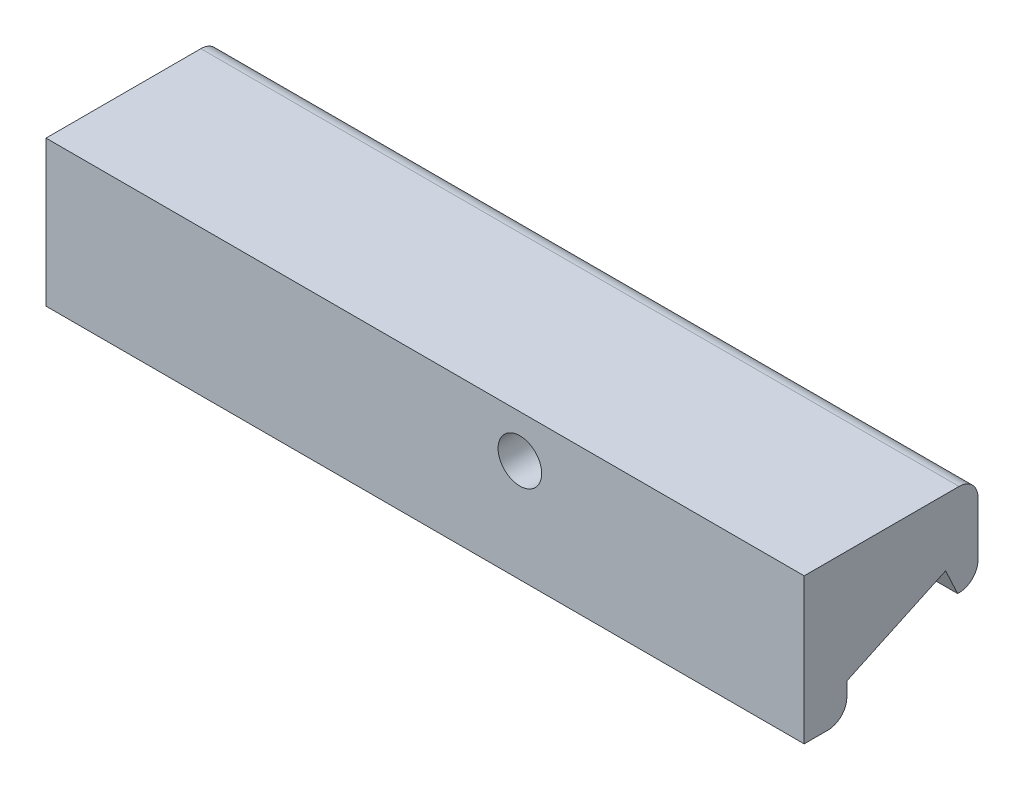
from build123d import *

# Parameters (mm, degrees)
PROFILEBOSS_EXTRUDE1_DEPTH           = 80
SKETCH2_R                            = 2.3
LEDSTRIPMOUNTHOLESCUT_EXTRUDE1_DEPTH = 4.5
SKETCH4_W                            = 28
SKETCH4_H                            = 11.5
POWERCONNECTORCUT_EXTRUDE4_DEPTH     = 6.5
SKETCH3_R                            = 2.3
MOUNTINGHOLESCUT_EXTRUDE3_DEPTH      = 4.5


with BuildPart() as part:
    # Sketch1 → ProfileBoss-Extrude1 (new body)
    with BuildSketch(Plane(origin=(0, 0, 0), x_dir=(0, 0, -1), z_dir=(1, 0, 0))):
        with BuildLine():
            Line((0, 0), (2.499461553, 0))
            ThreePointArc((2.499461553, 0), (3.914055855, 0.585944145), (4.5, 2.000538447))
            Line((4.5, 2.000538447), (4.5, 3.5))
            Line((4.5, 3.5), (14.922539551, 8.36011001))
            Line((14.922539551, 8.36011001), (16.190394336, 5.641186649))
            ThreePointArc((16.190394336, 5.641186649), (17.700753359, 6.16912635), (18.340729536, 7.635528477))
            Line((18.340729536, 7.635528477), (18.340729536, 13.36011001))
            ThreePointArc((18.340729536, 13.36011001), (17.754943098, 14.774323572), (16.340729536, 15.36011001))
            Line((16.340729536, 15.36011001), (0, 15.36011001))
            Line((0, 15.36011001), (0, 0))
        make_face()
    extrude(amount=PROFILEBOSS_EXTRUDE1_DEPTH)

    # Sketch2 → LedStripMountHolesCut-Extrude1 (cut)
    with BuildSketch(Plane(origin=(0, 1.15127832, 0.536849897), x_dir=(1, 0, 0), z_dir=(0, -0.906307787036651, -0.4226182617406973))):
        with Locations((36.15, -11.307548958)):
            Circle(SKETCH2_R)
    extrude(amount=-LEDSTRIPMOUNTHOLESCUT_EXTRUDE1_DEPTH, mode=Mode.SUBTRACT)

    # Sketch4 → PowerConnectorCut-Extrude4 (cut)
    with BuildSketch(Plane(origin=(0, 1.15127832, 0.536849897), x_dir=(1, 0, 0), z_dir=(0, -0.906307787036651, -0.4226182617406973))):
        with Locations((14, -11.307548958)):
            Rectangle(SKETCH4_W, SKETCH4_H)
    extrude(amount=-POWERCONNECTORCUT_EXTRUDE4_DEPTH, mode=Mode.SUBTRACT)

    # Sketch3 → MountingHolesCut-Extrude3 (cut)
    with BuildSketch(Plane.XY):
        with Locations((50, 10.86011001)):
            Circle(SKETCH3_R)
    extrude(amount=-MOUNTINGHOLESCUT_EXTRUDE3_DEPTH, mode=Mode.SUBTRACT)


solid = part.part
